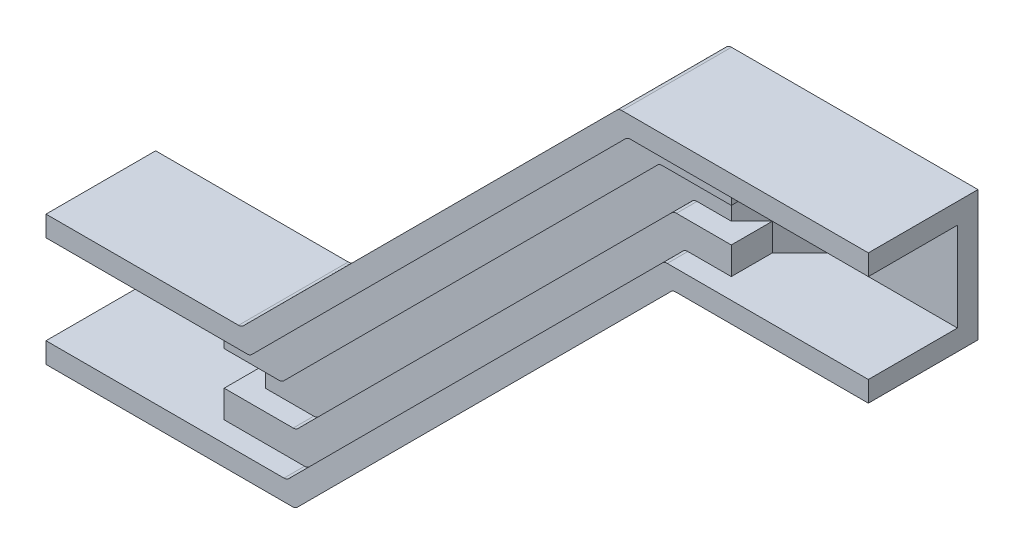
from build123d import *

# Parameters (mm, degrees)
SKETCH_10_R     = 1.65
EXTRUDE_1_DEPTH = 3
EXTRUDE_START   = 3
EXTRUDE_2_DEPTH = 7
EXTRUDE_3_DEPTH = 13
CHAMFER_1_SIZE  = 7
EXTRUDE_5_DEPTH = 10
FILLET_1_R      = 1


with BuildPart() as part:
    # 草图10 → 凸台-拉伸1 (new body)
    with BuildSketch(Plane.XY):
        Polygon((-60, -18.05), (-31.485028843, -18.05), (23.614971157, 37.05), (60, 37.05), (60, 18.05), (31.485028843, 18.05), (-23.614971157, -37.05), (-60, -37.05), align=None)
        with Locations((-50, -27.55)):
            Circle(SKETCH_10_R, mode=Mode.SUBTRACT)
        with Locations((50, 27.55)):
            Circle(SKETCH_10_R, mode=Mode.SUBTRACT)
    extrude(amount=EXTRUDE_1_DEPTH)

    # 草图11 → 凸台-拉伸2 (add)
    with BuildSketch(Plane.XY.offset(EXTRUDE_START)):
        Polygon((-41, -18.05), (-41, -37.05), (-23.614971157, -37.05), (31.485028843, 18.05), (41, 18.05), (41, 37.05), (23.614971157, 37.05), (-31.485028843, -18.05), align=None)
    extrude(amount=EXTRUDE_2_DEPTH)

    # 草图12 → 凸台-拉伸3 (add)
    with BuildSketch(Plane.XY.offset(EXTRUDE_START)):
        Polygon((-60, -18.05), (-31.485028843, -18.05), (23.614971157, 37.05), (60, 37.05), (60, 34.05), (24.857611845, 34.05), (-30.242388155, -21.05), (-60, -21.05), align=None)
        Polygon((-60, -34.05), (-60, -37.05), (-23.614971157, -37.05), (31.485028843, 18.05), (60, 18.05), (60, 21.05), (30.242388155, 21.05), (-24.857611845, -34.05), align=None)
    extrude(amount=EXTRUDE_3_DEPTH)

    # 倒角1
    chamfer_1_edges = [part.edges().sort_by_distance(p)[0] for p in [
        (41, 27.55, 10),
        (-41, -27.55, 10),
    ]]
    chamfer(chamfer_1_edges, length=CHAMFER_1_SIZE - 0.0001)  # a hair under: the kernel refuses the full size

    # 草图15 → 凸台-拉伸5 (add)
    with BuildSketch(Plane.XY.offset(3)):
        Polygon((-37, -21.05), (-37, -25.05), (-28.585533906, -25.05), (26.514466094, 30.05), (37, 30.05), (37, 34.05), (24.857611845, 34.05), (-30.242388155, -21.05), align=None)
        Polygon((-37, -30.05), (-37, -34.05), (-24.857611845, -34.05), (30.242388155, 21.05), (37, 21.05), (37, 25.05), (28.585533906, 25.05), (-26.514466094, -30.05), align=None)
    extrude(amount=EXTRUDE_5_DEPTH)

    # 圆角1
    fillet_1_edges = [part.edges().sort_by_distance(p)[0] for p in [
        (-31.485028843, -18.05, 8),
        (23.614971157, 37.05, 8),
        (31.485028843, 18.05, 8),
        (-23.614971157, -37.05, 8),
        (-28.585533906, -25.05, 11.5),
        (26.514466094, 30.05, 11.5),
        (-26.514466094, -30.05, 11.5),
        (28.585533906, 25.05, 11.5),
        (24.857611845, 34.05, 14.5),
        (-30.242388155, -21.05, 14.5),
        (-24.857611845, -34.05, 14.5),
        (30.242388155, 21.05, 14.5),
    ]]
    fillet(fillet_1_edges, radius=FILLET_1_R)


solid = part.part
